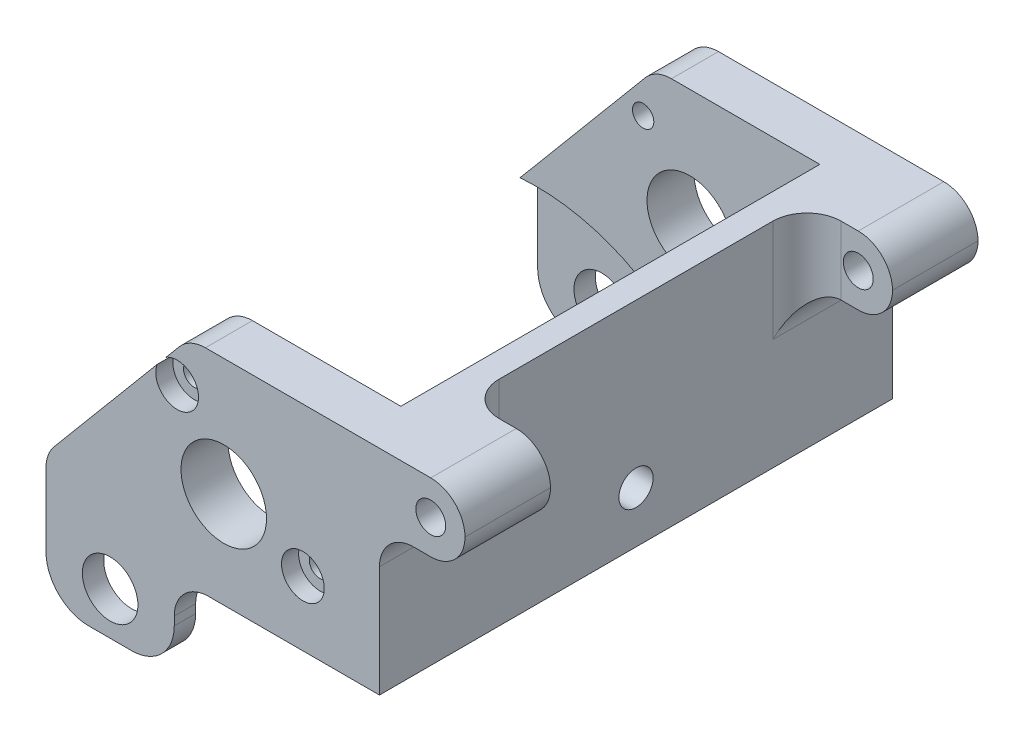
from build123d import *

# Parameters (mm, degrees)
BOSS_EXTRUDE1_DEPTH      = 30
BOSS_EXTRUDE1_DEPTH_BACK = 30
SKETCH2_R                = 3.25
SKETCH2_R_2              = 1.25
SKETCH2_R_3              = 5
SKETCH3_W                = 72
SKETCH3_H                = 55
CUT_EXTRUDE1_DEPTH       = 56.8323383
SKETCH4_W                = 10
SKETCH4_H                = 8
BOSS_EXTRUDE2_DEPTH      = 10
FILLET1_R                = 4
SKETCH5_R                = 1.75
CUT_EXTRUDE2_DEPTH       = 74.805487601
FILLET1_OF_MIRROR1_R     = 4
FILLET2_R                = 4
SKETCH6_R                = 1.25
SKETCH6_R_2              = 5
BOSS_EXTRUDE3_DEPTH      = 3
SKETCH7_R                = 2.5
CUT_EXTRUDE3_DEPTH       = 2
SKETCH8_R                = 2
CUT_EXTRUDE4_DEPTH       = 59.489315264


with BuildPart() as part:
    # Sketch2 → Boss-Extrude1 (new, two sides: drawn at the far end of the back side and taken through both)
    with BuildSketch(Plane.XY.offset(-BOSS_EXTRUDE1_DEPTH_BACK)):
        with BuildLine():
            Line((-7.5, 5), (-7.5, 15))
            Line((-7.5, 15), (9.281992624, 35))
            Line((9.281992624, 35), (31.5, 35))
            Line((31.5, 35), (31.5, 10))
            Line((31.5, 10), (7.5, 10))
            Line((7.5, 10), (7.5, 5))
            ThreePointArc((7.5, 5), (6.035533906, 1.464466094), (2.5, 0))
            Line((2.5, 0), (-2.5, 0))
            ThreePointArc((-2.5, 0), (-6.035533906, 1.464466094), (-7.5, 5))
        make_face()
        with Locations((0, 5)):
            Circle(SKETCH2_R, mode=Mode.SUBTRACT)
        with Locations((22.545074696, 17.568596061)):
            Circle(SKETCH2_R_2, mode=Mode.SUBTRACT)
        with Locations((7.834882147, 29.593995644)):
            Circle(SKETCH2_R_2, mode=Mode.SUBTRACT)
        with Locations((13.291231119, 21.258633871)):
            Circle(SKETCH2_R_3, mode=Mode.SUBTRACT)
    extrude(amount=BOSS_EXTRUDE1_DEPTH + BOSS_EXTRUDE1_DEPTH_BACK)

    # Sketch3 → Cut-Extrude1 (cut, through all)
    with BuildSketch(Plane(origin=(0, 35, 0), x_dir=(1, 0, 0), z_dir=(0, 1, 0))):
        with Locations((-7.5, 0)):
            Rectangle(SKETCH3_W, SKETCH3_H)
    extrude(amount=-CUT_EXTRUDE1_DEPTH, mode=Mode.SUBTRACT)

    # Sketch4 → Boss-Extrude2 (add)
    with BuildSketch(Plane(origin=(31.5, 0, 0), x_dir=(0, 0, -1), z_dir=(1, 0, 0))):
        with Locations((-25, 31)):
            Rectangle(SKETCH4_W, SKETCH4_H)
    boss_extrude2 = extrude(amount=BOSS_EXTRUDE2_DEPTH)

    # Fillet1
    fillet1_edges = [part.edges().sort_by_distance(p)[0] for p in [
        (41.5, 27, 25),
        (41.5, 35, 25),
    ]]
    fillet(fillet1_edges, radius=FILLET1_R - 0.0001)  # a hair under: the kernel refuses the full size

    # Sketch5 → Cut-Extrude2 (cut, through all)
    with BuildSketch(Plane(origin=(0, 0, 20), x_dir=(-1, 0, 0), z_dir=(0, 0, -1))):
        with Locations((-37.5, 31)):
            Circle(SKETCH5_R)
    cut_extrude2 = extrude(amount=-CUT_EXTRUDE2_DEPTH, mode=Mode.SUBTRACT)

    # Mirror1: Boss-Extrude2, Cut-Extrude2 across plane
    add(boss_extrude2.mirror(Plane.XY))
    add(cut_extrude2.mirror(Plane.XY), mode=Mode.SUBTRACT)

    # Fillet1 of Mirror1
    fillet1_of_mirror1_edges = [part.edges().sort_by_distance(p)[0] for p in [
        (41.5, 27, -25),
        (41.5, 35, -25),
    ]]
    fillet(fillet1_of_mirror1_edges, radius=FILLET1_OF_MIRROR1_R - 0.0001)  # a hair under: the kernel refuses the full size

    # Fillet2
    fillet2_edges = [part.edges().sort_by_distance(p)[0] for p in [
        (31.5, 27, 25),
        (31.5, 31, 20),
        (31.5, 27, -25),
        (31.5, 31, -20),
        (9.281992624, 35, -28.75),
        (7.5, 10, -28.75),
        (-7.5, 15, -28.75),
        (-7.5, 15, 28.75),
        (7.5, 10, 28.75),
        (9.281992624, 35, 28.75),
    ]]
    fillet(fillet2_edges, radius=FILLET2_R)

    # Sketch6 → Boss-Extrude3 (add)
    with BuildSketch(Plane.XY.offset(-27.5)):
        with BuildLine():
            Line((28.5, 35), (11.147223256, 35))
            ThreePointArc((11.147223256, 35), (9.456750209, 34.625231148), (8.083045484, 33.571150439))
            Line((8.083045484, 33.571150439), (-6.564177772, 16.115269502))
            ThreePointArc((-6.564177772, 16.115269502), (3.098200373, 14.919475381), (11.5, 10))
            Line((11.5, 10), (28.5, 10))
            Line((28.5, 10), (28.5, 35))
        make_face()
        with Locations((22.545074696, 17.568596061)):
            Circle(SKETCH6_R, mode=Mode.SUBTRACT)
        with Locations((13.291231119, 21.258633871)):
            Circle(SKETCH6_R_2, mode=Mode.SUBTRACT)
        with Locations((7.834882147, 29.593995644)):
            Circle(SKETCH6_R, mode=Mode.SUBTRACT)
    boss_extrude3 = extrude(amount=BOSS_EXTRUDE3_DEPTH)

    # Sketch7 → Cut-Extrude3 (cut)
    with BuildSketch(Plane(origin=(0, 0, -30), x_dir=(-1, 0, 0), z_dir=(0, 0, -1))):
        with Locations((-22.545074696, 17.568596061)):
            Circle(SKETCH7_R)
        with Locations((-7.834882147, 29.593995644)):
            Circle(SKETCH7_R)
    cut_extrude3 = extrude(amount=-CUT_EXTRUDE3_DEPTH, mode=Mode.SUBTRACT)

    # Mirror2: Boss-Extrude3, Cut-Extrude3 across plane
    add(boss_extrude3.mirror(Plane.XY))
    add(cut_extrude3.mirror(Plane.XY), mode=Mode.SUBTRACT)

    # Sketch8 → Cut-Extrude4 (cut, through all)
    with BuildSketch(Plane.ZY.offset(-28.5)):
        with Locations((0, 16)):
            Circle(SKETCH8_R)
    extrude(amount=-CUT_EXTRUDE4_DEPTH, mode=Mode.SUBTRACT)


solid = part.part
